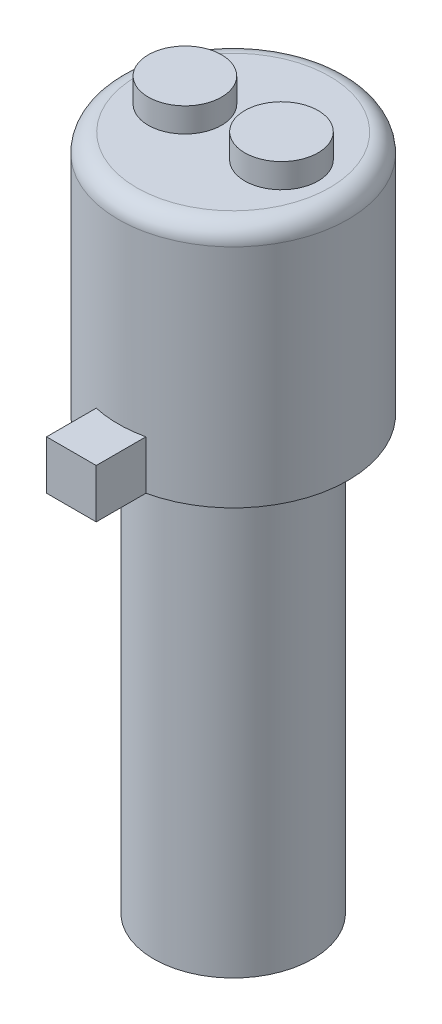
from build123d import *

# Parameters (mm, degrees)
SKETCH1_R           = 3.25
BOSS_EXTRUDE1_DEPTH = 17.686
SKETCH6_R           = 4.7
BOSS_EXTRUDE2_DEPTH = 10
FILLET2_R           = 0.75
SKETCH7_R           = 1.5
BOSS_EXTRUDE3_DEPTH = 1
BOSS_EXTRUDE4_DEPTH = 2


with BuildPart() as part:
    # Sketch1 → Boss-Extrude1 (new body)
    with BuildSketch(Plane(origin=(0, 0, 0), x_dir=(1, 0, 0), z_dir=(0, 1, 0))):
        Circle(SKETCH1_R)
    extrude(amount=BOSS_EXTRUDE1_DEPTH)

    # Sketch6 → Boss-Extrude2 (add)
    with BuildSketch(Plane(origin=(0, 17.686, 0), x_dir=(1, 0, 0), z_dir=(0, 1, 0))):
        Circle(SKETCH6_R)
    extrude(amount=BOSS_EXTRUDE2_DEPTH)

    # Fillet2
    fillet2_edges = [part.edges().sort_by_distance(p)[0] for p in [
        (-4.7, 27.686, 0),
    ]]
    fillet(fillet2_edges, radius=FILLET2_R)

    # Sketch7 → Boss-Extrude3 (add)
    with BuildSketch(Plane(origin=(0, 27.686, 0), x_dir=(1, 0, 0), z_dir=(0, 1, 0))):
        with Locations((-1.975, 0)):
            Circle(SKETCH7_R)
        with Locations((1.975, 0)):
            Circle(SKETCH7_R)
    extrude(amount=BOSS_EXTRUDE3_DEPTH)

    # Sketch8 → Boss-Extrude4 (add)
    with BuildSketch(Plane.XZ.offset(-17.686)):
        with BuildLine():
            Line((-1.016, 4.588871757), (-1.016, 6.620871757))
            Line((-1.016, 6.620871757), (1.016, 6.620871757))
            Line((1.016, 6.620871757), (1.016, 4.588871757))
            ThreePointArc((1.016, 4.588871757), (0, 4.7), (-1.016, 4.588871757))
        make_face()
    extrude(amount=-BOSS_EXTRUDE4_DEPTH)


solid = part.part
